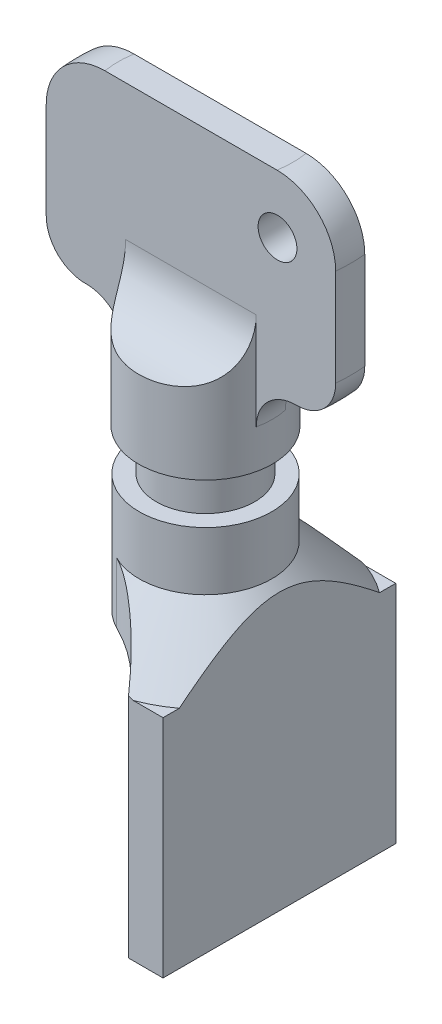
from build123d import *

# Parameters (mm, degrees)
BOSS_EXTRUDE1_DEPTH      = 10
FILLET2_R                = 2
FILLET3_R                = 3
CUT_EXTRUDE1_DEPTH       = 49.473897211
CUT_EXTRUDE1_DEPTH_BACK  = 49.473897211
SKETCH3_R                = 1
BOSS_EXTRUDE2_DEPTH      = 6
BOSS_EXTRUDE2_DEPTH_BACK = 6
SKETCH4_W                = 1.78
SKETCH4_H                = 11.625349657
CHAMFER1_SIZE            = 3
FILLET4_START            = 23
FILLET4_DEPTH            = 2.747219164
FILLET4_START_2          = 25.747219164
FILLET4_2_DEPTH          = 2.878130593
CHAMFER2_SIZE            = 2.5


with BuildPart() as part:
    # Sketch1 → Revolve1 (revolve)
    with BuildSketch(Plane.XY):
        Polygon((-3.448914015, 37.765821371), (-3.448914015, 33.765821371), (-2.534753992, 33.765821371), (-2.534753992, 31.624967984), (-3.41766068, 31.624967984), (-3.41766068, 23), (0, 23), (0, 37.765821371), align=None)
    revolve(axis=Axis((0, 37.765821371, 0), (0, -1, 0)))

    # Sketch2 → Boss-Extrude1 (add)
    with BuildSketch(Plane(origin=(0, 37.765821371, 0), x_dir=(1, 0, 0), z_dir=(0, 1, 0))):
        with BuildLine():
            Line((3.366379046, 0.75), (-3.366379046, 0.75))
            ThreePointArc((-3.366379046, 0.75), (-3.448914015, 0), (-3.366379046, -0.75))
            Line((-3.366379046, -0.75), (3.366379046, -0.75))
            ThreePointArc((3.366379046, -0.75), (3.428218178, -0.37726384), (3.448914015, 0))
            ThreePointArc((3.448914015, 0), (3.428218178, 0.37726384), (3.366379046, 0.75))
        make_face()
        with BuildLine():
            Line((-3.366379046, 0.75), (-7.462405778, 0.75))
            ThreePointArc((-7.462405778, 0.75), (-7.5, 0), (-7.462405778, -0.75))
            Line((-7.462405778, -0.75), (-3.366379046, -0.75))
            ThreePointArc((-3.366379046, -0.75), (-3.448914015, 0), (-3.366379046, 0.75))
        make_face()
        with BuildLine():
            ThreePointArc((7.5, 0), (7.490595548, 0.375470813), (7.462405778, 0.75))
            Line((7.462405778, 0.75), (3.366379046, 0.75))
            ThreePointArc((3.366379046, 0.75), (3.428218178, 0.37726384), (3.448914015, 0))
            ThreePointArc((3.448914015, 0), (3.428218178, -0.37726384), (3.366379046, -0.75))
            Line((3.366379046, -0.75), (7.462405778, -0.75))
            ThreePointArc((7.462405778, -0.75), (7.490595548, -0.375470813), (7.5, 0))
        make_face()
    extrude(amount=BOSS_EXTRUDE1_DEPTH)

    # Fillet2
    # the kernel refuses this fillet: 2 mm, written as the material it adds along each edge
    with BuildSketch(Plane(origin=(0, 37.765821371, 0), x_dir=(-0.09803421101524086, 0, -0.9951830452085783), z_dir=(-0.9951830452085783, 0, 0.09803421101524086))) as fillet2_piece_1_section:
        with BuildLine():
            CenterArc((3.448914015 + FILLET2_R, FILLET2_R), FILLET2_R, 180, 90)
            Line((3.448914015 + FILLET2_R, 0), (3.448914015, 0))
            Line((3.448914015, 0), (3.448914015, FILLET2_R))
        make_face()
    fillet2_piece_1 = revolve(axis=Axis((0, 37.765821371, 0), (0, -1, 0)), revolution_arc=191.251965623, mode=Mode.PRIVATE)
    fillet2_piece_1 = split(fillet2_piece_1, bisect_by=Plane(origin=(0, 37.765821371, -0.75), z_dir=(0, 0, 1)), keep=Keep.TOP, mode=Mode.PRIVATE)
    fillet2_piece_1 = split(fillet2_piece_1, bisect_by=Plane(origin=(0, 37.765821371, 0.75), z_dir=(0, 0, -1)), keep=Keep.TOP, mode=Mode.PRIVATE)
    add(fillet2_piece_1)
    with BuildSketch(Plane(origin=(0, 37.765821371, 0), x_dir=(0.09800035789508027, 0, 0.9951863794548418), z_dir=(0.9951863794548418, 0, -0.09800035789508027))) as fillet2_piece_2_section:
        with BuildLine():
            CenterArc((3.448914015 + FILLET2_R, FILLET2_R), FILLET2_R, 180, 90)
            Line((3.448914015 + FILLET2_R, 0), (3.448914015, 0))
            Line((3.448914015, 0), (3.448914015, FILLET2_R))
        make_face()
    fillet2_piece_2 = revolve(axis=Axis((0, 37.765821371, 0), (0, -1, 0)), revolution_arc=95.624033786, mode=Mode.PRIVATE)
    fillet2_piece_2 = split(fillet2_piece_2, bisect_by=Plane(origin=(0, 37.765821371, 0.75), z_dir=(0, 0, -1)), keep=Keep.TOP, mode=Mode.PRIVATE)
    add(fillet2_piece_2)
    with BuildSketch(Plane(origin=(0, 37.765821371, 0), x_dir=(-1, 0, 0), z_dir=(0, 0, 1))) as fillet2_piece_3_section:
        with BuildLine():
            CenterArc((3.448914015 + FILLET2_R, FILLET2_R), FILLET2_R, 180, 90)
            Line((3.448914015 + FILLET2_R, 0), (3.448914015, 0))
            Line((3.448914015, 0), (3.448914015, FILLET2_R))
        make_face()
    fillet2_piece_3 = revolve(axis=Axis((0, 37.765821371, 0), (0, -1, 0)), revolution_arc=95.624033786, mode=Mode.PRIVATE)
    fillet2_piece_3 = split(fillet2_piece_3, bisect_by=Plane(origin=(0, 37.765821371, -0.75), z_dir=(0, 0, 1)), keep=Keep.TOP, mode=Mode.PRIVATE)
    add(fillet2_piece_3)
    # the kernel refuses this fillet: 2 mm, written as the material it takes off along each edge
    with BuildSketch(Plane(origin=(0, 37.765821371, 0), x_dir=(-0.7201079494948177, 0, -0.6938620475817721), z_dir=(0.6938620475817721, 0, -0.7201079494948177))) as fillet2_2_piece_1:
        with BuildLine():
            CenterArc((7.5 - FILLET2_R, FILLET2_R), FILLET2_R, 270, 90)
            Line((7.5, FILLET2_R), (7.5, 0))
            Line((7.5, 0), (7.5 - FILLET2_R, 0))
        make_face()
    revolve(axis=Axis((0, 37.765821371, 0), (0, 1, 0)), revolution_arc=87.873212667, mode=Mode.SUBTRACT)
    with BuildSketch(Plane(origin=(0, 37.765821371, 0), x_dir=(0.7201079494948216, 0, 0.6938620475817678), z_dir=(-0.6938620475817678, 0, 0.7201079494948216))) as fillet2_2_piece_2:
        with BuildLine():
            CenterArc((7.5 - FILLET2_R, FILLET2_R), FILLET2_R, 270, 90)
            Line((7.5 - FILLET2_R, 0), (7.5, 0))
            Line((7.5, 0), (7.5, FILLET2_R))
        make_face()
    revolve(axis=Axis((0, 37.765821371, 0), (0, 1, 0)), revolution_arc=87.873212667, mode=Mode.SUBTRACT)

    # Fillet3
    # the kernel refuses this fillet: 3 mm, written as the material it adds along each edge
    with BuildSketch(Plane(origin=(10.866379046, 37.765821371, -0.75), x_dir=(0, 1, 0), z_dir=(-1, 0, 0))) as fillet3_piece_1_section:
        with BuildLine():
            CenterArc((FILLET3_R, FILLET3_R), FILLET3_R, 180, 90)
            Line((0, FILLET3_R), (0, 0))
            Line((0, 0), (FILLET3_R, 0))
        make_face()
    fillet3_piece_1 = extrude(amount=21.732758092, mode=Mode.PRIVATE)
    fillet3_piece_1 = fillet3_piece_1 & Plane(origin=(0, 37.765821371, 0), x_dir=(-1, 0, 0), z_dir=(0, -1, 0)) * Cylinder(3.448914015, 56, mode=Mode.PRIVATE)
    add(fillet3_piece_1)
    with BuildSketch(Plane(origin=(10.866379046, 37.765821371, 0.75), x_dir=(0, 1, 0), z_dir=(-1, 0, 0))) as fillet3_piece_2_section:
        with BuildLine():
            CenterArc((FILLET3_R, -FILLET3_R), FILLET3_R, 90, 90)
            Line((0, -FILLET3_R), (0, 0))
            Line((0, 0), (FILLET3_R, 0))
        make_face()
    fillet3_piece_2 = extrude(amount=21.732758092, mode=Mode.PRIVATE)
    fillet3_piece_2 = fillet3_piece_2 & Plane(origin=(0, 37.765821371, 0), x_dir=(-1, 0, 0), z_dir=(0, -1, 0)) * Cylinder(3.448914015, 56, mode=Mode.PRIVATE)
    add(fillet3_piece_2)
    # the kernel refuses this fillet: 3 mm, written as the material it takes off along each edge
    with BuildSketch(Plane(origin=(0, 47.765821371, 0), x_dir=(-0.4534410859899706, 0, -0.8912862511764871), z_dir=(0.8912862511764871, 0, -0.4534410859899706))) as fillet3_2_piece_1:
        with BuildLine():
            CenterArc((7.5 - FILLET3_R, -FILLET3_R), FILLET3_R, 0, 90)
            Line((7.5 - FILLET3_R, 0), (7.5, 0))
            Line((7.5, 0), (7.5, -FILLET3_R))
        make_face()
    revolve(axis=Axis((0, 47.765821371, 0), (0, 1, 0)), revolution_arc=126.070648523, mode=Mode.SUBTRACT)
    with BuildSketch(Plane(origin=(0, 47.765821371, 0), x_dir=(0.4534410859901425, 0, -0.8912862511763997), z_dir=(-0.8912862511763997, 0, -0.4534410859901425))) as fillet3_2_piece_2:
        with BuildLine():
            CenterArc((7.5 - FILLET3_R, FILLET3_R), FILLET3_R, 270, 90)
            Line((7.5, FILLET3_R), (7.5, 0))
            Line((7.5, 0), (7.5 - FILLET3_R, 0))
        make_face()
    revolve(axis=Axis((0, 47.765821371, 0), (0, -1, 0)), revolution_arc=126.070648523, mode=Mode.SUBTRACT)

    # Sketch3 → Cut-Extrude1 (cut, two sides: drawn at the far end of the back side and taken through both)
    with BuildSketch(Plane.XY.offset(-CUT_EXTRUDE1_DEPTH_BACK)):
        with Locations((4.462405778, 44.765821371)):
            Circle(SKETCH3_R)
    extrude(amount=CUT_EXTRUDE1_DEPTH + CUT_EXTRUDE1_DEPTH_BACK, mode=Mode.SUBTRACT)

    # Sketch4 → Boss-Extrude2 (add, two sides: drawn at the far end of the back side and taken through both)
    with BuildSketch(Plane.XY.offset(-BOSS_EXTRUDE2_DEPTH_BACK)):
        with Locations((2.92, 19.812674829)):
            Rectangle(SKETCH4_W, SKETCH4_H)
    extrude(amount=BOSS_EXTRUDE2_DEPTH + BOSS_EXTRUDE2_DEPTH_BACK)

    # Chamfer1
    # the kernel refuses this chamfer: 3 mm, written as the material it adds along each edge
    with BuildSketch(Plane(origin=(0, 25.625349657, 0), x_dir=(-0.9999950652018582, 0, -0.003141587485879368), z_dir=(-0.003141587485879368, 0, 0.9999950652018582))) as chamfer1_piece_1_section:
        Polygon((3.41766068, -CHAMFER1_SIZE), (3.41766068 + CHAMFER1_SIZE, 0), (3.41766068, 0), align=None)
    chamfer1_piece_1 = revolve(axis=Axis((0, 25.625349657, 0), (0, -1, 0)), revolution_arc=359.64, mode=Mode.PRIVATE)
    chamfer1_piece_1 = split(chamfer1_piece_1, bisect_by=Plane(origin=(2.03, 25.625349657, 0), z_dir=(1, 0, 0)), keep=Keep.TOP, mode=Mode.PRIVATE)
    chamfer1_piece_1 = split(chamfer1_piece_1, bisect_by=Plane(origin=(0, 25.625349657, -6), z_dir=(0, 0, 1)), keep=Keep.TOP, mode=Mode.PRIVATE)
    chamfer1_piece_1 = split(chamfer1_piece_1, bisect_by=Plane(origin=(3.81, 25.625349657, 0), z_dir=(-1, 0, 0)), keep=Keep.TOP, mode=Mode.PRIVATE)
    chamfer1_piece_1 = split(chamfer1_piece_1, bisect_by=Plane(origin=(0, 25.625349657, 6), z_dir=(0, 0, -1)), keep=Keep.TOP, mode=Mode.PRIVATE)
    add(chamfer1_piece_1)

    # Fillet4: read off the stored shape, not the designer's step
    # Fillet4 outline → Fillet4 (add)
    with BuildSketch(Plane(origin=(0, 0, 0), x_dir=(1, 0, 0), z_dir=(0, 1, 0)).offset(FILLET4_START)):
        with BuildLine():
            Line((2.03, 2.749455314), (2.03, 6))
            ThreePointArc((2.03, 6), (0.428490728, 4.324777263), (-1.515640098, 3.063207407))
            ThreePointArc((-1.515640098, 3.063207407), (0.301250097, 3.404357928), (2.03, 2.749455314))
        make_face()
        with BuildLine():
            ThreePointArc((2.03, -2.749455314), (0.301250097, -3.404357928), (-1.515640098, -3.063207407))
            ThreePointArc((-1.515640098, -3.063207407), (0.428490728, -4.324777263), (2.03, -6))
            Line((2.03, -6), (2.03, -2.749455314))
        make_face()
    extrude(amount=FILLET4_DEPTH)

    # Fillet4 2 outline → Fillet4 2 (add)
    with BuildSketch(Plane(origin=(0, 0, 0), x_dir=(1, 0, 0), z_dir=(0, 1, 0)).offset(FILLET4_START_2)):
        with BuildLine():
            Line((2.03, 2.749455314), (2.03, 6))
            ThreePointArc((2.03, 6), (0.428490728, 4.324777263), (-1.515640098, 3.063207407))
            ThreePointArc((-1.515640098, 3.063207407), (0.301250097, 3.404357928), (2.03, 2.749455314))
        make_face()
        with BuildLine():
            ThreePointArc((2.03, -2.749455314), (0.301250097, -3.404357928), (-1.515640098, -3.063207407))
            ThreePointArc((-1.515640098, -3.063207407), (0.428490728, -4.324777263), (2.03, -6))
            Line((2.03, -6), (2.03, -2.749455314))
        make_face()
    extrude(amount=FILLET4_2_DEPTH)

    # Fillet4 3 outline → Fillet4 3 (revolve, cut)
    with BuildSketch(Plane.XY):
        Polygon((6.334106093, 28.625349757), (3.41766068, 28.625349757), (6.41766068, 25.625349657), (6.41766068, 28.62535645), align=None)
    revolve(axis=Axis((0, 0, 0), (0, 1, 0)), mode=Mode.SUBTRACT)

    # Chamfer2
    chamfer2_edges = [part.edges().sort_by_distance(p)[0] for p in [
        (-2.903476201, 23, 1.80283956),
        (0.428490728, 23, -4.324777263),
        (0.428490728, 23, 4.324777263),
    ]]
    chamfer(chamfer2_edges, length=CHAMFER2_SIZE)


solid = part.part
